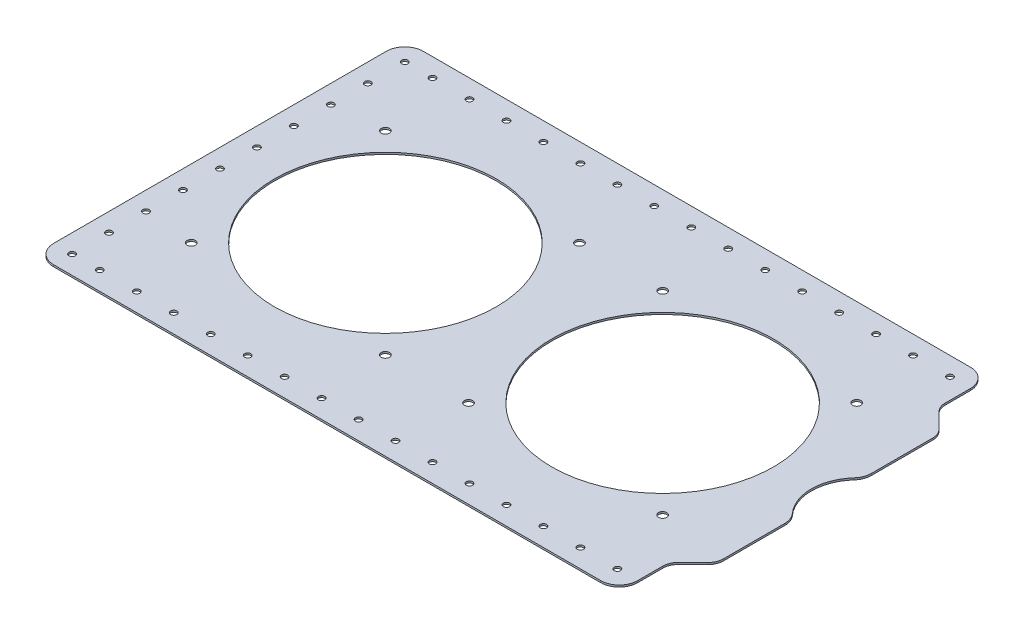
from build123d import *

# Parameters (mm, degrees)
SKETCH1_W                      = 329
SKETCH1_H                      = 200
BOSS_EXTRUDE1_DEPTH            = 1
CUT_EXTRUDE1_DEPTH             = 193.512986575
FILLET1_R                      = 8
FILLET2_R                      = 10
SKETCH3_R                      = 1.7
CUT_EXTRUDE2_DEPTH             = 193.512986575
M3_CLEARANCE_HOLE1_AT_2_COUNT  = 2
M3_CLEARANCE_HOLE1_AT_2_PITCH  = 20
M3_CLEARANCE_HOLE1_AT_3_COUNT  = 2
M3_CLEARANCE_HOLE1_AT_3_PITCH  = 40
M3_CLEARANCE_HOLE1_AT_4_COUNT  = 2
M3_CLEARANCE_HOLE1_AT_4_PITCH  = 60
M3_CLEARANCE_HOLE1_AT_5_COUNT  = 2
M3_CLEARANCE_HOLE1_AT_5_PITCH  = 80
M3_CLEARANCE_HOLE1_AT_6_COUNT  = 2
M3_CLEARANCE_HOLE1_AT_6_PITCH  = 100
M3_CLEARANCE_HOLE1_AT_7_COUNT  = 2
M3_CLEARANCE_HOLE1_AT_7_PITCH  = 120
M3_CLEARANCE_HOLE2_AT_2_COUNT  = 2
M3_CLEARANCE_HOLE2_AT_2_PITCH  = 20
M3_CLEARANCE_HOLE2_AT_3_COUNT  = 2
M3_CLEARANCE_HOLE2_AT_3_PITCH  = 40
M3_CLEARANCE_HOLE2_AT_4_COUNT  = 2
M3_CLEARANCE_HOLE2_AT_4_PITCH  = 60
M3_CLEARANCE_HOLE2_AT_5_COUNT  = 2
M3_CLEARANCE_HOLE2_AT_5_PITCH  = 80
M3_CLEARANCE_HOLE2_AT_6_COUNT  = 2
M3_CLEARANCE_HOLE2_AT_6_PITCH  = 100
M3_CLEARANCE_HOLE2_AT_7_COUNT  = 2
M3_CLEARANCE_HOLE2_AT_7_PITCH  = 120
M3_CLEARANCE_HOLE2_AT_8_COUNT  = 2
M3_CLEARANCE_HOLE2_AT_8_PITCH  = 140
M3_CLEARANCE_HOLE2_AT_9_COUNT  = 2
M3_CLEARANCE_HOLE2_AT_9_PITCH  = 160
M3_CLEARANCE_HOLE2_AT_10_COUNT = 2
M3_CLEARANCE_HOLE2_AT_10_PITCH = 180
M3_CLEARANCE_HOLE2_AT_11_COUNT = 2
M3_CLEARANCE_HOLE2_AT_11_PITCH = 200
M3_CLEARANCE_HOLE2_AT_12_COUNT = 2
M3_CLEARANCE_HOLE2_AT_12_PITCH = 220
M3_CLEARANCE_HOLE2_AT_13_COUNT = 2
M3_CLEARANCE_HOLE2_AT_13_PITCH = 240
M3_CLEARANCE_HOLE2_AT_14_COUNT = 2
M3_CLEARANCE_HOLE2_AT_14_PITCH = 260
M3_CLEARANCE_HOLE2_AT_15_COUNT = 2
M3_CLEARANCE_HOLE2_AT_15_PITCH = 280
M3_CLEARANCE_HOLE2_AT_16_COUNT = 2
M3_CLEARANCE_HOLE2_AT_16_PITCH = 332.866339542
M3_CLEARANCE_HOLE2_AT_17_COUNT = 2
M3_CLEARANCE_HOLE2_AT_17_PITCH = 316.227766017
M3_CLEARANCE_HOLE2_AT_18_COUNT = 2
M3_CLEARANCE_HOLE2_AT_18_PITCH = 300
M3_CLEARANCE_HOLE2_AT_19_COUNT = 2
M3_CLEARANCE_HOLE2_AT_19_PITCH = 284.253408071
M3_CLEARANCE_HOLE2_AT_20_COUNT = 2
M3_CLEARANCE_HOLE2_AT_20_PITCH = 269.072480941
M3_CLEARANCE_HOLE2_AT_21_COUNT = 2
M3_CLEARANCE_HOLE2_AT_21_PITCH = 254.558441227
M3_CLEARANCE_HOLE2_AT_22_COUNT = 2
M3_CLEARANCE_HOLE2_AT_22_PITCH = 240.831891576
M3_CLEARANCE_HOLE2_AT_23_COUNT = 2
M3_CLEARANCE_HOLE2_AT_23_PITCH = 228.03508502
M3_CLEARANCE_HOLE2_AT_24_COUNT = 2
M3_CLEARANCE_HOLE2_AT_24_PITCH = 216.333076528
M3_CLEARANCE_HOLE2_AT_25_COUNT = 2
M3_CLEARANCE_HOLE2_AT_25_PITCH = 205.91260282
M3_CLEARANCE_HOLE2_AT_26_COUNT = 2
M3_CLEARANCE_HOLE2_AT_26_PITCH = 196.977156036
M3_CLEARANCE_HOLE2_AT_27_COUNT = 2
M3_CLEARANCE_HOLE2_AT_27_PITCH = 189.73665961
M3_CLEARANCE_HOLE2_AT_28_COUNT = 2
M3_CLEARANCE_HOLE2_AT_28_PITCH = 184.390889146
M3_CLEARANCE_HOLE2_AT_29_COUNT = 2
M3_CLEARANCE_HOLE2_AT_29_PITCH = 181.107702763
M3_CLEARANCE_HOLE2_AT_30_COUNT = 2
M3_CLEARANCE_HOLE2_AT_30_PITCH = 180
SKETCH9_R                      = 25
CUT_EXTRUDE3_DEPTH             = 10
FILLET3_R                      = 10
M4_CLEARANCE_HOLE1_AT_2_COUNT  = 2
M4_CLEARANCE_HOLE1_AT_2_PITCH  = 183.098334236
M4_CLEARANCE_HOLE1_AT_3_COUNT  = 2
M4_CLEARANCE_HOLE1_AT_3_PITCH  = 255
M4_CLEARANCE_HOLE1_AT_4_COUNT  = 2
M4_CLEARANCE_HOLE1_AT_4_PITCH  = 275.771644663
M4_CLEARANCE_HOLE1_AT_5_COUNT  = 2
M4_CLEARANCE_HOLE1_AT_5_PITCH  = 150
M4_CLEARANCE_HOLE1_AT_6_COUNT  = 2
M4_CLEARANCE_HOLE1_AT_6_PITCH  = 105
M4_CLEARANCE_HOLE1_AT_7_COUNT  = 2
M4_CLEARANCE_HOLE1_AT_7_PITCH  = 148.492424049
M4_CLEARANCE_HOLE1_AT_8_COUNT  = 2
M4_CLEARANCE_HOLE1_AT_8_PITCH  = 105
SKETCH12_R                     = 60
CUT_EXTRUDE4_DEPTH             = 10


with BuildPart() as part:
    # Sketch1 → Boss-Extrude1 (new body)
    with BuildSketch(Plane(origin=(0, 0, 0), x_dir=(1, 0, 0), z_dir=(0, 1, 0))):
        Rectangle(SKETCH1_W, SKETCH1_H)
    extrude(amount=BOSS_EXTRUDE1_DEPTH)

    # Sketch2 → Cut-Extrude1 (cut, through all)
    with BuildSketch(Plane(origin=(0, 0, 0), x_dir=(-1, 0, 0), z_dir=(0, -1, 0))):
        Polygon((-164.5, -60), (-151.5, -73), (-151.5, -100), (-164.5, -100), align=None)
        Polygon((-151.5, 100), (-164.5, 100), (-164.5, 60), (-151.5, 73), align=None)
    extrude(amount=-CUT_EXTRUDE1_DEPTH, mode=Mode.SUBTRACT)

    # Fillet1
    fillet1_edges = [part.edges().sort_by_distance(p)[0] for p in [
        (151.5, 0.5, -73),
        (164.5, 0.5, -60),
        (151.5, 0.5, 73),
        (164.5, 0.5, 60),
    ]]
    fillet(fillet1_edges, radius=FILLET1_R)

    # Fillet2
    fillet2_edges = [part.edges().sort_by_distance(p)[0] for p in [
        (151.5, 0.5, -100),
        (-164.5, 0.5, -100),
        (-164.5, 0.5, 100),
        (151.5, 0.5, 100),
    ]]
    fillet(fillet2_edges, radius=FILLET2_R)

    # Sketch3 → Cut-Extrude2 (cut, through all)
    with BuildSketch(Plane.XZ):
        with Locations((-154.5, -70)):
            Circle(SKETCH3_R)
        with Locations((-154.5, -90)):
            Circle(SKETCH3_R)
        with Locations((-154.5, 70)):
            Circle(SKETCH3_R)
        with Locations((-154.5, 90)):
            Circle(SKETCH3_R)
    extrude(amount=-CUT_EXTRUDE2_DEPTH, mode=Mode.SUBTRACT)

    # Sketch6 → M3 Clearance Hole1 (revolve, cut)
    with BuildSketch(Plane(origin=(-154.5, 0, 70), x_dir=(0, 0, -1), z_dir=(1, 0, 0))):
        Polygon((0, 0), (0, 1), (1.7, 1), (1.7, 0.025), (1.725, 0), align=None)
    m3_clearance_hole1 = revolve(axis=Axis((-154.5, -6.35, 70), (0, 1, 0)), mode=Mode.SUBTRACT)

    # M3 Clearance Hole1 at 2: M3 Clearance Hole1 ×2
    with Locations(*[(0, 0, -i * M3_CLEARANCE_HOLE1_AT_2_PITCH) for i in range(1, M3_CLEARANCE_HOLE1_AT_2_COUNT)]):
        add(m3_clearance_hole1, mode=Mode.SUBTRACT)

    # M3 Clearance Hole1 at 3: M3 Clearance Hole1 ×2
    with Locations(*[(0, 0, -i * M3_CLEARANCE_HOLE1_AT_3_PITCH) for i in range(1, M3_CLEARANCE_HOLE1_AT_3_COUNT)]):
        add(m3_clearance_hole1, mode=Mode.SUBTRACT)

    # M3 Clearance Hole1 at 4: M3 Clearance Hole1 ×2
    with Locations(*[(0, 0, -i * M3_CLEARANCE_HOLE1_AT_4_PITCH) for i in range(1, M3_CLEARANCE_HOLE1_AT_4_COUNT)]):
        add(m3_clearance_hole1, mode=Mode.SUBTRACT)

    # M3 Clearance Hole1 at 5: M3 Clearance Hole1 ×2
    with Locations(*[(0, 0, -i * M3_CLEARANCE_HOLE1_AT_5_PITCH) for i in range(1, M3_CLEARANCE_HOLE1_AT_5_COUNT)]):
        add(m3_clearance_hole1, mode=Mode.SUBTRACT)

    # M3 Clearance Hole1 at 6: M3 Clearance Hole1 ×2
    with Locations(*[(0, 0, -i * M3_CLEARANCE_HOLE1_AT_6_PITCH) for i in range(1, M3_CLEARANCE_HOLE1_AT_6_COUNT)]):
        add(m3_clearance_hole1, mode=Mode.SUBTRACT)

    # M3 Clearance Hole1 at 7: M3 Clearance Hole1 ×2
    with Locations(*[(0, 0, -i * M3_CLEARANCE_HOLE1_AT_7_PITCH) for i in range(1, M3_CLEARANCE_HOLE1_AT_7_COUNT)]):
        add(m3_clearance_hole1, mode=Mode.SUBTRACT)

    # Sketch8 → M3 Clearance Hole2 (revolve, cut)
    with BuildSketch(Plane(origin=(140.5, 0, -90), x_dir=(0, 0, -1), z_dir=(1, 0, 0))):
        Polygon((0, 0), (0, 1), (1.7, 1), (1.7, 0.025), (1.725, 0), align=None)
    m3_clearance_hole2 = revolve(axis=Axis((140.5, -6.35, -90), (0, 1, 0)), mode=Mode.SUBTRACT)

    # M3 Clearance Hole2 at 2: M3 Clearance Hole2 ×2
    with Locations(*[(-i * M3_CLEARANCE_HOLE2_AT_2_PITCH, 0, 0) for i in range(1, M3_CLEARANCE_HOLE2_AT_2_COUNT)]):
        add(m3_clearance_hole2, mode=Mode.SUBTRACT)

    # M3 Clearance Hole2 at 3: M3 Clearance Hole2 ×2
    with Locations(*[(-i * M3_CLEARANCE_HOLE2_AT_3_PITCH, 0, 0) for i in range(1, M3_CLEARANCE_HOLE2_AT_3_COUNT)]):
        add(m3_clearance_hole2, mode=Mode.SUBTRACT)

    # M3 Clearance Hole2 at 4: M3 Clearance Hole2 ×2
    with Locations(*[(-i * M3_CLEARANCE_HOLE2_AT_4_PITCH, 0, 0) for i in range(1, M3_CLEARANCE_HOLE2_AT_4_COUNT)]):
        add(m3_clearance_hole2, mode=Mode.SUBTRACT)

    # M3 Clearance Hole2 at 5: M3 Clearance Hole2 ×2
    with Locations(*[(-i * M3_CLEARANCE_HOLE2_AT_5_PITCH, 0, 0) for i in range(1, M3_CLEARANCE_HOLE2_AT_5_COUNT)]):
        add(m3_clearance_hole2, mode=Mode.SUBTRACT)

    # M3 Clearance Hole2 at 6: M3 Clearance Hole2 ×2
    with Locations(*[(-i * M3_CLEARANCE_HOLE2_AT_6_PITCH, 0, 0) for i in range(1, M3_CLEARANCE_HOLE2_AT_6_COUNT)]):
        add(m3_clearance_hole2, mode=Mode.SUBTRACT)

    # M3 Clearance Hole2 at 7: M3 Clearance Hole2 ×2
    with Locations(*[(-i * M3_CLEARANCE_HOLE2_AT_7_PITCH, 0, 0) for i in range(1, M3_CLEARANCE_HOLE2_AT_7_COUNT)]):
        add(m3_clearance_hole2, mode=Mode.SUBTRACT)

    # M3 Clearance Hole2 at 8: M3 Clearance Hole2 ×2
    with Locations(*[(-i * M3_CLEARANCE_HOLE2_AT_8_PITCH, 0, 0) for i in range(1, M3_CLEARANCE_HOLE2_AT_8_COUNT)]):
        add(m3_clearance_hole2, mode=Mode.SUBTRACT)

    # M3 Clearance Hole2 at 9: M3 Clearance Hole2 ×2
    with Locations(*[(-i * M3_CLEARANCE_HOLE2_AT_9_PITCH, 0, 0) for i in range(1, M3_CLEARANCE_HOLE2_AT_9_COUNT)]):
        add(m3_clearance_hole2, mode=Mode.SUBTRACT)

    # M3 Clearance Hole2 at 10: M3 Clearance Hole2 ×2
    with Locations(*[(-i * M3_CLEARANCE_HOLE2_AT_10_PITCH, 0, 0) for i in range(1, M3_CLEARANCE_HOLE2_AT_10_COUNT)]):
        add(m3_clearance_hole2, mode=Mode.SUBTRACT)

    # M3 Clearance Hole2 at 11: M3 Clearance Hole2 ×2
    with Locations(*[(-i * M3_CLEARANCE_HOLE2_AT_11_PITCH, 0, 0) for i in range(1, M3_CLEARANCE_HOLE2_AT_11_COUNT)]):
        add(m3_clearance_hole2, mode=Mode.SUBTRACT)

    # M3 Clearance Hole2 at 12: M3 Clearance Hole2 ×2
    with Locations(*[(-i * M3_CLEARANCE_HOLE2_AT_12_PITCH, 0, 0) for i in range(1, M3_CLEARANCE_HOLE2_AT_12_COUNT)]):
        add(m3_clearance_hole2, mode=Mode.SUBTRACT)

    # M3 Clearance Hole2 at 13: M3 Clearance Hole2 ×2
    with Locations(*[(-i * M3_CLEARANCE_HOLE2_AT_13_PITCH, 0, 0) for i in range(1, M3_CLEARANCE_HOLE2_AT_13_COUNT)]):
        add(m3_clearance_hole2, mode=Mode.SUBTRACT)

    # M3 Clearance Hole2 at 14: M3 Clearance Hole2 ×2
    with Locations(*[(-i * M3_CLEARANCE_HOLE2_AT_14_PITCH, 0, 0) for i in range(1, M3_CLEARANCE_HOLE2_AT_14_COUNT)]):
        add(m3_clearance_hole2, mode=Mode.SUBTRACT)

    # M3 Clearance Hole2 at 15: M3 Clearance Hole2 ×2
    with Locations(*[(-i * M3_CLEARANCE_HOLE2_AT_15_PITCH, 0, 0) for i in range(1, M3_CLEARANCE_HOLE2_AT_15_COUNT)]):
        add(m3_clearance_hole2, mode=Mode.SUBTRACT)

    # M3 Clearance Hole2 at 16: M3 Clearance Hole2 ×2
    with Locations(*[Vector(-0.8411784753765535, 0, 0.5407575913134988) * (i * M3_CLEARANCE_HOLE2_AT_16_PITCH) for i in range(1, M3_CLEARANCE_HOLE2_AT_16_COUNT)]):
        add(m3_clearance_hole2, mode=Mode.SUBTRACT)

    # M3 Clearance Hole2 at 17: M3 Clearance Hole2 ×2
    with Locations(*[Vector(-0.8221921916437787, 0, 0.5692099788303084) * (i * M3_CLEARANCE_HOLE2_AT_17_PITCH) for i in range(1, M3_CLEARANCE_HOLE2_AT_17_COUNT)]):
        add(m3_clearance_hole2, mode=Mode.SUBTRACT)

    # M3 Clearance Hole2 at 18: M3 Clearance Hole2 ×2
    with Locations(*[Vector(-0.8, 0, 0.6000000000000001) * (i * M3_CLEARANCE_HOLE2_AT_18_PITCH) for i in range(1, M3_CLEARANCE_HOLE2_AT_18_COUNT)]):
        add(m3_clearance_hole2, mode=Mode.SUBTRACT)

    # M3 Clearance Hole2 at 19: M3 Clearance Hole2 ×2
    with Locations(*[Vector(-0.773957299203321, 0, 0.6332377902572627) * (i * M3_CLEARANCE_HOLE2_AT_19_PITCH) for i in range(1, M3_CLEARANCE_HOLE2_AT_19_COUNT)]):
        add(m3_clearance_hole2, mode=Mode.SUBTRACT)

    # M3 Clearance Hole2 at 20: M3 Clearance Hole2 ×2
    with Locations(*[Vector(-0.7432941462471663, 0, 0.6689647316224497) * (i * M3_CLEARANCE_HOLE2_AT_20_PITCH) for i in range(1, M3_CLEARANCE_HOLE2_AT_20_COUNT)]):
        add(m3_clearance_hole2, mode=Mode.SUBTRACT)

    # M3 Clearance Hole2 at 21: M3 Clearance Hole2 ×2
    with Locations(*[Vector(-0.7071067811865475, 0, 0.7071067811865476) * (i * M3_CLEARANCE_HOLE2_AT_21_PITCH) for i in range(1, M3_CLEARANCE_HOLE2_AT_21_COUNT)]):
        add(m3_clearance_hole2, mode=Mode.SUBTRACT)

    # M3 Clearance Hole2 at 22: M3 Clearance Hole2 ×2
    with Locations(*[Vector(-0.6643638388299197, 0, 0.7474093186836598) * (i * M3_CLEARANCE_HOLE2_AT_22_PITCH) for i in range(1, M3_CLEARANCE_HOLE2_AT_22_COUNT)]):
        add(m3_clearance_hole2, mode=Mode.SUBTRACT)

    # M3 Clearance Hole2 at 23: M3 Clearance Hole2 ×2
    with Locations(*[Vector(-0.6139406135149205, 0, 0.7893522173763263) * (i * M3_CLEARANCE_HOLE2_AT_23_PITCH) for i in range(1, M3_CLEARANCE_HOLE2_AT_23_COUNT)]):
        add(m3_clearance_hole2, mode=Mode.SUBTRACT)

    # M3 Clearance Hole2 at 24: M3 Clearance Hole2 ×2
    with Locations(*[Vector(-0.554700196225229, 0, 0.8320502943378437) * (i * M3_CLEARANCE_HOLE2_AT_24_PITCH) for i in range(1, M3_CLEARANCE_HOLE2_AT_24_COUNT)]):
        add(m3_clearance_hole2, mode=Mode.SUBTRACT)

    # M3 Clearance Hole2 at 25: M3 Clearance Hole2 ×2
    with Locations(*[Vector(-0.48564293117863216, 0, 0.8741572761215377) * (i * M3_CLEARANCE_HOLE2_AT_25_PITCH) for i in range(1, M3_CLEARANCE_HOLE2_AT_25_COUNT)]):
        add(m3_clearance_hole2, mode=Mode.SUBTRACT)

    # M3 Clearance Hole2 at 26: M3 Clearance Hole2 ×2
    with Locations(*[Vector(-0.4061384660534476, 0, 0.9138115486202572) * (i * M3_CLEARANCE_HOLE2_AT_26_PITCH) for i in range(1, M3_CLEARANCE_HOLE2_AT_26_COUNT)]):
        add(m3_clearance_hole2, mode=Mode.SUBTRACT)

    # M3 Clearance Hole2 at 27: M3 Clearance Hole2 ×2
    with Locations(*[Vector(-0.316227766016838, 0, 0.9486832980505139) * (i * M3_CLEARANCE_HOLE2_AT_27_PITCH) for i in range(1, M3_CLEARANCE_HOLE2_AT_27_COUNT)]):
        add(m3_clearance_hole2, mode=Mode.SUBTRACT)

    # M3 Clearance Hole2 at 28: M3 Clearance Hole2 ×2
    with Locations(*[Vector(-0.2169304578186562, 0, 0.9761870601839527) * (i * M3_CLEARANCE_HOLE2_AT_28_PITCH) for i in range(1, M3_CLEARANCE_HOLE2_AT_28_COUNT)]):
        add(m3_clearance_hole2, mode=Mode.SUBTRACT)

    # M3 Clearance Hole2 at 29: M3 Clearance Hole2 ×2
    with Locations(*[Vector(-0.11043152607484662, 0, 0.9938837346736189) * (i * M3_CLEARANCE_HOLE2_AT_29_PITCH) for i in range(1, M3_CLEARANCE_HOLE2_AT_29_COUNT)]):
        add(m3_clearance_hole2, mode=Mode.SUBTRACT)

    # M3 Clearance Hole2 at 30: M3 Clearance Hole2 ×2
    with Locations(*[(0, 0, i * M3_CLEARANCE_HOLE2_AT_30_PITCH) for i in range(1, M3_CLEARANCE_HOLE2_AT_30_COUNT)]):
        add(m3_clearance_hole2, mode=Mode.SUBTRACT)

    # Sketch9 → Cut-Extrude3 (cut)
    with BuildSketch(Plane(origin=(0, 0, 0), x_dir=(-1, 0, 0), z_dir=(0, -1, 0))):
        with Locations((-180.5, 0)):
            Circle(SKETCH9_R)
    extrude(amount=-CUT_EXTRUDE3_DEPTH, mode=Mode.SUBTRACT)

    # Fillet3
    fillet3_edges = [part.edges().sort_by_distance(p)[0] for p in [
        (164.5, 0.5, -19.209372712),
        (164.5, 0.5, 19.209372712),
    ]]
    fillet(fillet3_edges, radius=FILLET3_R)

    # Sketch11 → M4 Clearance Hole1 (revolve, cut)
    with BuildSketch(Plane(origin=(127.5, 0, 52.5), x_dir=(0, 0, -1), z_dir=(1, 0, 0))):
        Polygon((0, 0), (0, 1), (2.25, 1), (2.25, 0.025), (2.275, 0), align=None)
    m4_clearance_hole1 = revolve(axis=Axis((127.5, -6.35, 52.5), (0, 1, 0)), mode=Mode.SUBTRACT)

    # M4 Clearance Hole1 at 2: M4 Clearance Hole1 ×2
    with Locations(*[Vector(-0.8192319205190406, 0, -0.5734623443633283) * (i * M4_CLEARANCE_HOLE1_AT_2_PITCH) for i in range(1, M4_CLEARANCE_HOLE1_AT_2_COUNT)]):
        add(m4_clearance_hole1, mode=Mode.SUBTRACT)

    # M4 Clearance Hole1 at 3: M4 Clearance Hole1 ×2
    with Locations(*[(-i * M4_CLEARANCE_HOLE1_AT_3_PITCH, 0, 0) for i in range(1, M4_CLEARANCE_HOLE1_AT_3_COUNT)]):
        add(m4_clearance_hole1, mode=Mode.SUBTRACT)

    # M4 Clearance Hole1 at 4: M4 Clearance Hole1 ×2
    with Locations(*[Vector(-0.924678098474716, 0, -0.38074980525429486) * (i * M4_CLEARANCE_HOLE1_AT_4_PITCH) for i in range(1, M4_CLEARANCE_HOLE1_AT_4_COUNT)]):
        add(m4_clearance_hole1, mode=Mode.SUBTRACT)

    # M4 Clearance Hole1 at 5: M4 Clearance Hole1 ×2
    with Locations(*[(-i * M4_CLEARANCE_HOLE1_AT_5_PITCH, 0, 0) for i in range(1, M4_CLEARANCE_HOLE1_AT_5_COUNT)]):
        add(m4_clearance_hole1, mode=Mode.SUBTRACT)

    # M4 Clearance Hole1 at 6: M4 Clearance Hole1 ×2
    with Locations(*[(0, 0, -i * M4_CLEARANCE_HOLE1_AT_6_PITCH) for i in range(1, M4_CLEARANCE_HOLE1_AT_6_COUNT)]):
        add(m4_clearance_hole1, mode=Mode.SUBTRACT)

    # M4 Clearance Hole1 at 7: M4 Clearance Hole1 ×2
    with Locations(*[Vector(-0.7071067811865476, 0, -0.7071067811865475) * (i * M4_CLEARANCE_HOLE1_AT_7_PITCH) for i in range(1, M4_CLEARANCE_HOLE1_AT_7_COUNT)]):
        add(m4_clearance_hole1, mode=Mode.SUBTRACT)

    # M4 Clearance Hole1 at 8: M4 Clearance Hole1 ×2
    with Locations(*[(-i * M4_CLEARANCE_HOLE1_AT_8_PITCH, 0, 0) for i in range(1, M4_CLEARANCE_HOLE1_AT_8_COUNT)]):
        add(m4_clearance_hole1, mode=Mode.SUBTRACT)

    # Sketch12 → Cut-Extrude4 (cut)
    with BuildSketch(Plane(origin=(0, 0, 0), x_dir=(-1, 0, 0), z_dir=(0, -1, 0))):
        with Locations((75, 0)):
            Circle(SKETCH12_R)
        with Locations((-75, 0)):
            Circle(SKETCH12_R)
    extrude(amount=-CUT_EXTRUDE4_DEPTH, mode=Mode.SUBTRACT)


solid = part.part
